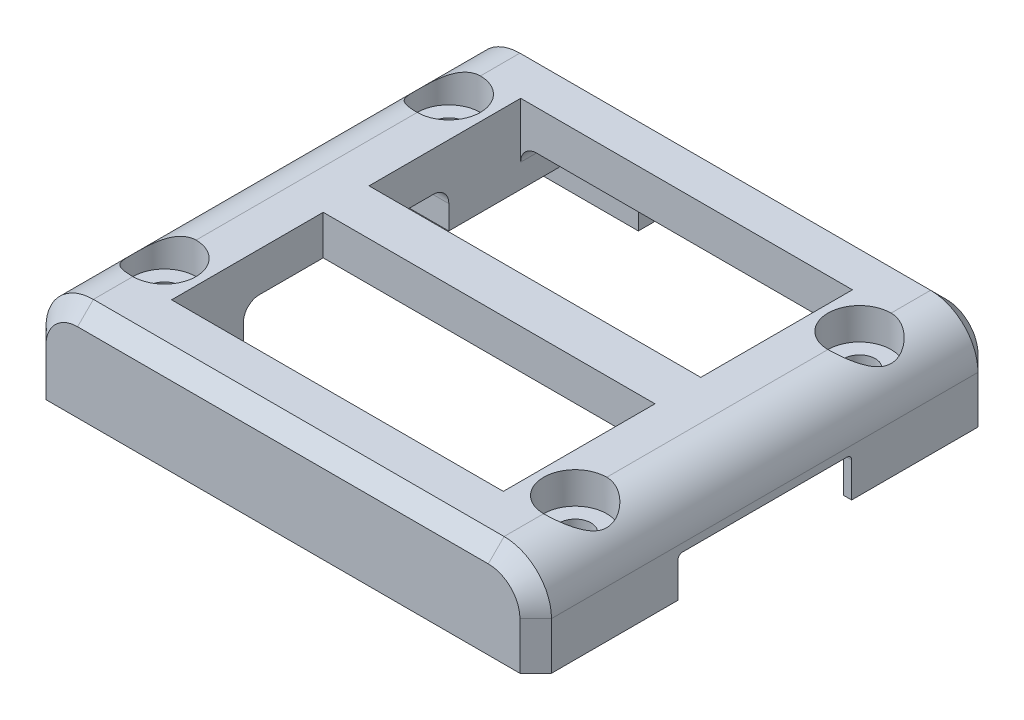
from build123d import *

# Parameters (mm, degrees)
SKETCH1_W           = 32
SKETCH1_H           = 29
BOSS_EXTRUDE1_DEPTH = 6
SKETCH2_R           = 1
CUT_EXTRUDE1_DEPTH  = 10
SKETCH3_W           = 21
SKETCH3_H           = 9.6
CUT_EXTRUDE2_DEPTH  = 10
SKETCH4_W           = 31
SKETCH4_H           = 27
CUT_EXTRUDE3_DEPTH  = 1
FILLET2_R           = 3
SKETCH5_R           = 2
CUT_EXTRUDE4_DEPTH  = 2
CHAMFER2_SIZE       = 1
SKETCH6_W           = 1
SKETCH6_H           = 11
CUT_EXTRUDE5_DEPTH  = 2.5
FILLET3_R           = 0.3
SKETCH7_W           = 31
SKETCH7_H           = 13
CUT_EXTRUDE6_DEPTH  = 2.5
FILLET4_R           = 1
SKETCH_1_W          = 21
SKETCH_1_H          = 12.05
CUT_EXTRUDE_1_DEPTH = 2.5
FILLET_1_R          = 1
SKETCH_2_W          = 11
SKETCH_2_H          = 2.5
CUT_EXTRUDE_2_DEPTH = 33.802439001
FILLET_2_R          = 0.3


with BuildPart() as part:
    # Sketch1 → Boss-Extrude1 (new body)
    with BuildSketch(Plane(origin=(0, 0, 0), x_dir=(1, 0, 0), z_dir=(0, 1, 0))):
        Rectangle(SKETCH1_W, SKETCH1_H)
    extrude(amount=BOSS_EXTRUDE1_DEPTH)

    # Sketch2 → Cut-Extrude1 (cut)
    with BuildSketch(Plane(origin=(0, 6, 0), x_dir=(1, 0, 0), z_dir=(0, 1, 0))):
        with Locations(Location((-13, 9, 0), (0, 0, 270))):
            Circle(SKETCH2_R)
        with Locations(Location((13, 9, 0), (0, 0, 270))):
            Circle(SKETCH2_R)
        with Locations(Location((13, -9, 0), (0, 0, 270))):
            Circle(SKETCH2_R)
        with Locations(Location((-13, -9, 0), (0, 0, 270))):
            Circle(SKETCH2_R)
    extrude(amount=-CUT_EXTRUDE1_DEPTH, mode=Mode.SUBTRACT)

    # Sketch3 → Cut-Extrude2 (cut)
    with BuildSketch(Plane(origin=(0, 6, 0), x_dir=(1, 0, 0), z_dir=(0, 1, 0))):
        with Locations((0, 6.25)):
            Rectangle(SKETCH3_W, SKETCH3_H)
        with Locations((0, -6.25)):
            Rectangle(SKETCH3_W, SKETCH3_H)
    extrude(amount=-CUT_EXTRUDE2_DEPTH, mode=Mode.SUBTRACT)

    # Sketch4 → Cut-Extrude3 (cut)
    with BuildSketch(Plane.XZ):
        Rectangle(SKETCH4_W, SKETCH4_H)
    extrude(amount=-CUT_EXTRUDE3_DEPTH, mode=Mode.SUBTRACT)

    # Fillet2
    # the kernel refuses this fillet: 3 mm, written as the material it takes off along each edge
    with BuildSketch(Plane(origin=(16, 6, 22), x_dir=(0, -1, 0), z_dir=(0, 0, -1)), Plane(origin=(-16, 6, -22), x_dir=(0, -1, 0), z_dir=(0, 0, 1))) as fillet2_piece_1:
        with BuildLine():
            CenterArc((FILLET2_R, FILLET2_R), FILLET2_R, 180, 90)
            Line((0, FILLET2_R), (0, 0))
            Line((0, 0), (FILLET2_R, 0))
        make_face()
    extrude(amount=44, mode=Mode.SUBTRACT)

    # Sketch5 → Cut-Extrude4 (cut)
    with BuildSketch(Plane(origin=(0, 6, 0), x_dir=(1, 0, 0), z_dir=(0, 1, 0))):
        with Locations(Location((-13, 9, 0), (0, 0, 270))):
            Circle(SKETCH5_R)
        with Locations(Location((13, 9, 0), (0, 0, 270))):
            Circle(SKETCH5_R)
        with Locations(Location((13, -9, 0), (0, 0, 270))):
            Circle(SKETCH5_R)
        with Locations(Location((-13, -9, 0), (0, 0, 270))):
            Circle(SKETCH5_R)
    extrude(amount=-CUT_EXTRUDE4_DEPTH, mode=Mode.SUBTRACT)

    # Chamfer2
    chamfer2_edges = [part.edges().sort_by_distance(p)[0] for p in [
        (-16, 1.5, 14.5),
        (-16, 1.5, -14.5),
        (0, 6, -14.5),
        (16, 1.5, -14.5),
        (15.121320344, 5.121320344, -14.5),
        (-15.121320344, 5.121320344, -14.5),
        (0, 6, 14.5),
        (16, 1.5, 14.5),
        (15.121320344, 5.121320344, 14.5),
        (-15.121320344, 5.121320344, 14.5),
    ]]
    chamfer(chamfer2_edges, length=CHAMFER2_SIZE)

    # Sketch6 → Cut-Extrude5 (cut)
    with BuildSketch(Plane.XZ):
        with Locations((-15.5, 0)):
            Rectangle(SKETCH6_W, SKETCH6_H)
        with Locations((15.5, 0)):
            Rectangle(SKETCH6_W, SKETCH6_H)
    extrude(amount=-CUT_EXTRUDE5_DEPTH, mode=Mode.SUBTRACT)

    # Fillet3
    fillet3_edges = [part.edges().sort_by_distance(p)[0] for p in [
        (-15.5, 2.5, 5.5),
        (-15.5, 2.5, -5.5),
        (15.5, 2.5, -5.5),
        (15.5, 2.5, 5.5),
    ]]
    fillet(fillet3_edges, radius=FILLET3_R)

    # Sketch7 → Cut-Extrude6 (cut)
    with BuildSketch(Plane.XZ.offset(-1)):
        Rectangle(SKETCH7_W, SKETCH7_H)
    extrude(amount=-CUT_EXTRUDE6_DEPTH, mode=Mode.SUBTRACT)

    # Fillet4
    fillet4_edges = [part.edges().sort_by_distance(p)[0] for p in [
        (-13, 3.5, 6.5),
        (13, 3.5, 6.5),
        (-13, 3.5, -6.5),
        (13, 3.5, -6.5),
    ]]
    fillet(fillet4_edges, radius=FILLET4_R)

    # Эскиз1 → Вырез-Вытянуть1 (cut)
    with BuildSketch(Plane.XZ.offset(-1)):
        with Locations((0, -7.475)):
            Rectangle(SKETCH_1_W, SKETCH_1_H)
    extrude(amount=-CUT_EXTRUDE_1_DEPTH, mode=Mode.SUBTRACT)

    # Скругление1
    fillet_1_edges = [part.edges().sort_by_distance(p)[0] for p in [
        (10.5, 3.5, -12.275),
        (-10.5, 3.5, -12.275),
    ]]
    fillet(fillet_1_edges, radius=FILLET_1_R)

    # Эскиз2 → Вырез-Вытянуть2 (cut, through all)
    with BuildSketch(Plane.XY.offset(-13.5)):
        with Locations((0, 1.25)):
            Rectangle(SKETCH_2_W, SKETCH_2_H)
    extrude(amount=-CUT_EXTRUDE_2_DEPTH, mode=Mode.SUBTRACT)

    # Скругление2
    fillet_2_edges = [part.edges().sort_by_distance(p)[0] for p in [
        (5.5, 2.5, -14),
        (-5.5, 2.5, -14),
    ]]
    fillet(fillet_2_edges, radius=FILLET_2_R)


solid = part.part
